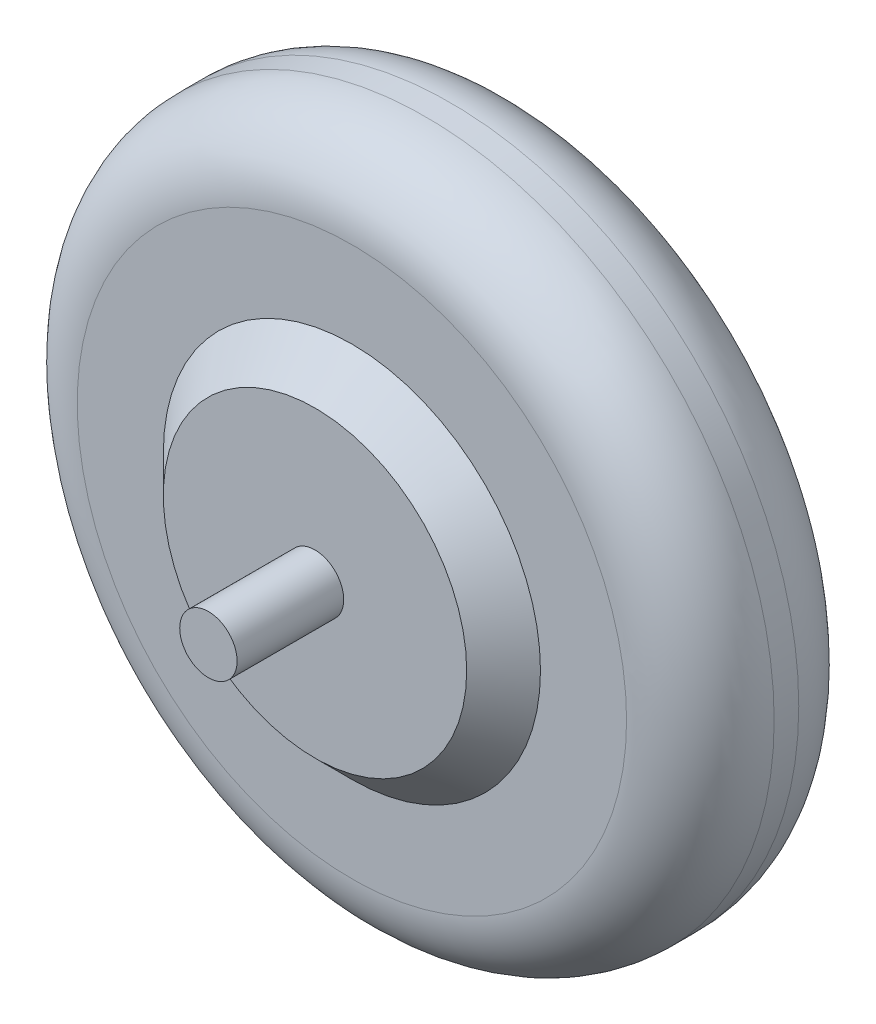
from build123d import *

# Parameters (mm, degrees)
SKETCH_1_R           = 85
EXTRUDE_1_DEPTH      = 21
SKETCH_2_R           = 47
EXTRUDE_2_DEPTH      = 30
CHAMFER_1_SIZE       = 10
SKETCH_3_R           = 7
EXTRUDE_3_DEPTH      = 32
SKETCH_5_OUTSIDE_W   = 223.484
SKETCH_5_OUTSIDE_H   = 223.484
SKETCH_5_OUTSIDE_W_2 = 10
SKETCH_5_OUTSIDE_H_2 = 14
CUT_EXTRUDE_1_DEPTH  = 28
CHAMFER_3_SIZE       = 1
SKETCH_7_R           = 3.5
CUT_EXTRUDE_2_DEPTH  = 45
SKETCH_8_R           = 7
CUT_EXTRUDE_4_DEPTH  = 5
FILLET_1_R           = 18
EXTRUDE_START        = 26
SKETCH_10_R          = 7
EXTRUDE_4_DEPTH      = 26


with BuildPart() as part:
    # 草图1 → 凸台-拉伸1 (new, symmetric)
    with BuildSketch(Plane.XY):
        with Locations(Location((0, 0, 0), (0, 0, 180))):
            Circle(SKETCH_1_R)
    extrude(amount=EXTRUDE_1_DEPTH, both=True)

    # 草图2 → 凸台-拉伸2 (add, symmetric)
    with BuildSketch(Plane.XY):
        Circle(SKETCH_2_R)
    extrude(amount=EXTRUDE_2_DEPTH, both=True)

    # 倒角1
    # the kernel refuses this chamfer: 10 mm, written as the material it takes off along each edge
    with BuildSketch(Plane(origin=(0, 0, -30), x_dir=(1, 0, 0), z_dir=(0, -1, 0))) as chamfer_1_piece_1_section:
        Polygon((47, CHAMFER_1_SIZE), (47 - CHAMFER_1_SIZE, 0), (47, 0), align=None)
    chamfer_1_piece_1 = revolve(axis=Axis((0, 0, -30), (0, 0, 1)), mode=Mode.PRIVATE)
    chamfer_1_piece_1 = split(chamfer_1_piece_1, bisect_by=Plane(origin=(-41.532222796, 0, -21), z_dir=(0, 0, -1)), keep=Keep.TOP, mode=Mode.PRIVATE)
    add(chamfer_1_piece_1, mode=Mode.SUBTRACT)
    with BuildSketch(Plane(origin=(0, 0, 30), x_dir=(1, 0, 0), z_dir=(0, -1, 0))) as chamfer_1_piece_2_section:
        Polygon((47, -CHAMFER_1_SIZE), (47 - CHAMFER_1_SIZE, 0), (47, 0), align=None)
    chamfer_1_piece_2 = revolve(axis=Axis((0, 0, 30), (0, 0, 1)), mode=Mode.PRIVATE)
    chamfer_1_piece_2 = split(chamfer_1_piece_2, bisect_by=Plane(origin=(-41.532222796, 0, 21), z_dir=(0, 0, 1)), keep=Keep.TOP, mode=Mode.PRIVATE)
    add(chamfer_1_piece_2, mode=Mode.SUBTRACT)

    # 草图3 → 凸台-拉伸3 (add)
    with BuildSketch(Plane(origin=(0, 0, -30), x_dir=(-1, 0, 0), z_dir=(0, 0, -1))):
        with Locations(Location((0, 0, 0), (0, 0, 180))):
            Circle(SKETCH_3_R)
    extrude(amount=EXTRUDE_3_DEPTH)

    # 草图5 outside → 切除-拉伸1 (cut)
    with BuildSketch(Plane(origin=(0, 0, -62), x_dir=(-1, 0, 0), z_dir=(0, 0, -1))):
        Rectangle(SKETCH_5_OUTSIDE_W, SKETCH_5_OUTSIDE_H)
        Rectangle(SKETCH_5_OUTSIDE_W_2, SKETCH_5_OUTSIDE_H_2, mode=Mode.SUBTRACT)
    extrude(amount=-CUT_EXTRUDE_1_DEPTH, mode=Mode.SUBTRACT)

    # 倒角3
    # the kernel refuses this chamfer: 1 mm, written as the material it takes off along each edge
    with BuildSketch(Plane(origin=(0, 0, -62), x_dir=(-0.9180065533872216, 0.39656521271805273, 0), z_dir=(-0.39656521271805273, -0.9180065533872216, 0))) as chamfer_3_piece_1:
        Polygon((7, -CHAMFER_3_SIZE), (7 - CHAMFER_3_SIZE, 0), (7, 0), align=None)
    revolve(axis=Axis((0, 0, -62), (0, 0, -1)), revolution_arc=66.636371816, mode=Mode.SUBTRACT)
    with BuildSketch(Plane(origin=(0, 0, -62), x_dir=(0.9180065533873013, -0.3965652127178682, 0), z_dir=(0.3965652127178682, 0.9180065533873013, 0))) as chamfer_3_piece_2:
        Polygon((7, -CHAMFER_3_SIZE), (7 - CHAMFER_3_SIZE, 0), (7, 0), align=None)
    revolve(axis=Axis((0, 0, -62), (0, 0, -1)), revolution_arc=66.636371927, mode=Mode.SUBTRACT)
    with BuildSketch(Plane(origin=(0, 0, -62), x_dir=(-1.935452947399645e-09, -1.0, 0), z_dir=(1.0, -1.935452947399645e-09, 0))) as chamfer_3_piece_3:
        Polygon((7, -CHAMFER_3_SIZE), (7 - CHAMFER_3_SIZE, 0), (7, 0), align=None)
    revolve(axis=Axis((0, 0, -62), (0, 0, -1)), revolution_arc=66.636371706, mode=Mode.SUBTRACT)
    with BuildSketch(Plane(origin=(0, 0, -62), x_dir=(0, 1, 0), z_dir=(-1, 0, 0))) as chamfer_3_piece_4:
        Polygon((7, -CHAMFER_3_SIZE), (7 - CHAMFER_3_SIZE, 0), (7, 0), align=None)
    revolve(axis=Axis((0, 0, -62), (0, 0, -1)), revolution_arc=66.636371816, mode=Mode.SUBTRACT)

    # 草图7 → 切除-拉伸2 (cut)
    with BuildSketch(Plane(origin=(0, 0, -62), x_dir=(-1, 0, 0), z_dir=(0, 0, -1))):
        Circle(SKETCH_7_R)
    extrude(amount=-CUT_EXTRUDE_2_DEPTH, mode=Mode.SUBTRACT)

    # 草图8 → 切除-拉伸4 (cut)
    with BuildSketch(Plane(origin=(5, 0, 0), x_dir=(0, 0, -1), z_dir=(1, 0, 0))):
        with Locations((62, 0)):
            Circle(SKETCH_8_R)
    extrude(amount=-CUT_EXTRUDE_4_DEPTH, mode=Mode.SUBTRACT)

    # 圆角1
    fillet_1_edges = [part.edges().sort_by_distance(p)[0] for p in [
        (85, 0, -21),
        (85, 0, 21),
    ]]
    fillet(fillet_1_edges, radius=FILLET_1_R)

    # 草图10 → 凸台-拉伸4 (add)
    with BuildSketch(Plane.XY.offset(30).offset(EXTRUDE_START)):
        Circle(SKETCH_10_R)
    extrude(amount=-EXTRUDE_4_DEPTH)


solid = part.part
